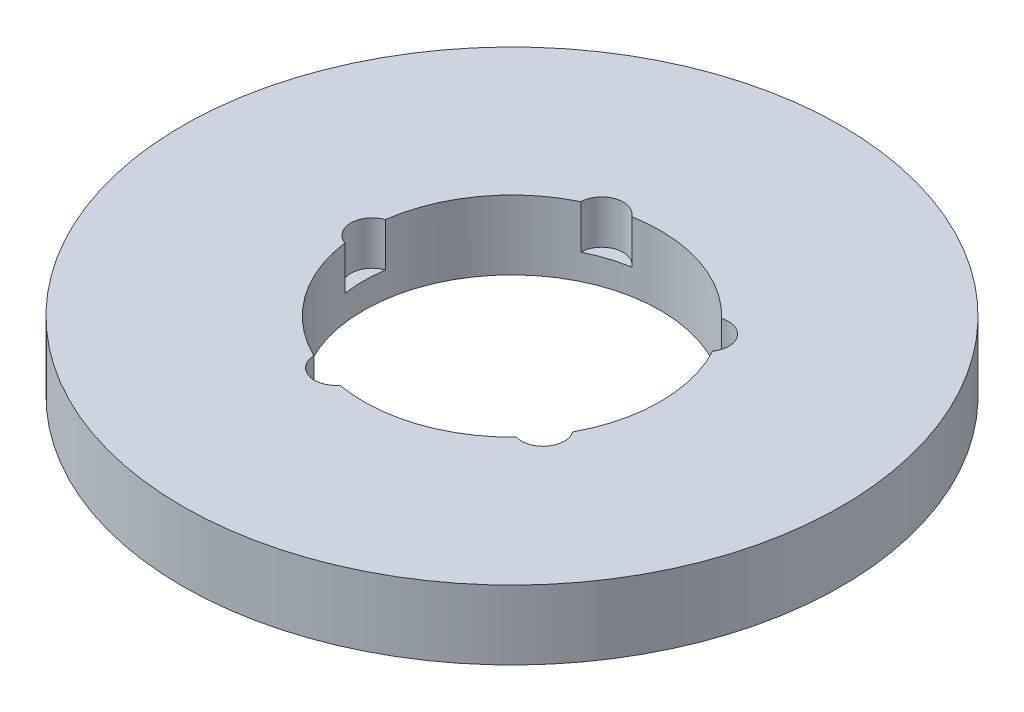
from build123d import *

# Parameters (mm, degrees)
SKETCH1_R           = 100
BOSS_EXTRUDE1_DEPTH = 21
SKETCH2_R           = 45
CUT_EXTRUDE1_DEPTH  = 143.972025236
SKETCH3_R           = 6.510216071
CUT_EXTRUDE2_DEPTH  = 13.241542945
CIRPATTERN1_COUNT   = 5


with BuildPart() as part:
    # Sketch1 → Boss-Extrude1 (new body)
    with BuildSketch(Plane(origin=(0, 0, 0), x_dir=(1, 0, 0), z_dir=(0, 1, 0))):
        Circle(SKETCH1_R)
    extrude(amount=BOSS_EXTRUDE1_DEPTH)

    # Sketch2 → Cut-Extrude1 (cut, through all)
    with BuildSketch(Plane(origin=(0, 0, 0), x_dir=(1, 0, 0), z_dir=(0, 1, 0))):
        Circle(SKETCH2_R)
    extrude(amount=CUT_EXTRUDE1_DEPTH, mode=Mode.SUBTRACT)

    # Sketch3 → Cut-Extrude2 (cut)
    with BuildSketch(Plane(origin=(0, 21, 0), x_dir=(1, 0, 0), z_dir=(0, 1, 0))):
        with Locations((-42.412248075, 0)):
            Circle(SKETCH3_R)
    cut_extrude2 = extrude(amount=-CUT_EXTRUDE2_DEPTH, mode=Mode.SUBTRACT)

    # CirPattern1: Cut-Extrude2 ×5 about axis
    cirpattern1_axis = Axis((0, 0, 0), (0, 1, 0))
    for i in range(1, CIRPATTERN1_COUNT):
        add(cut_extrude2.rotate(cirpattern1_axis, i * 360 / CIRPATTERN1_COUNT), mode=Mode.SUBTRACT)


solid = part.part
